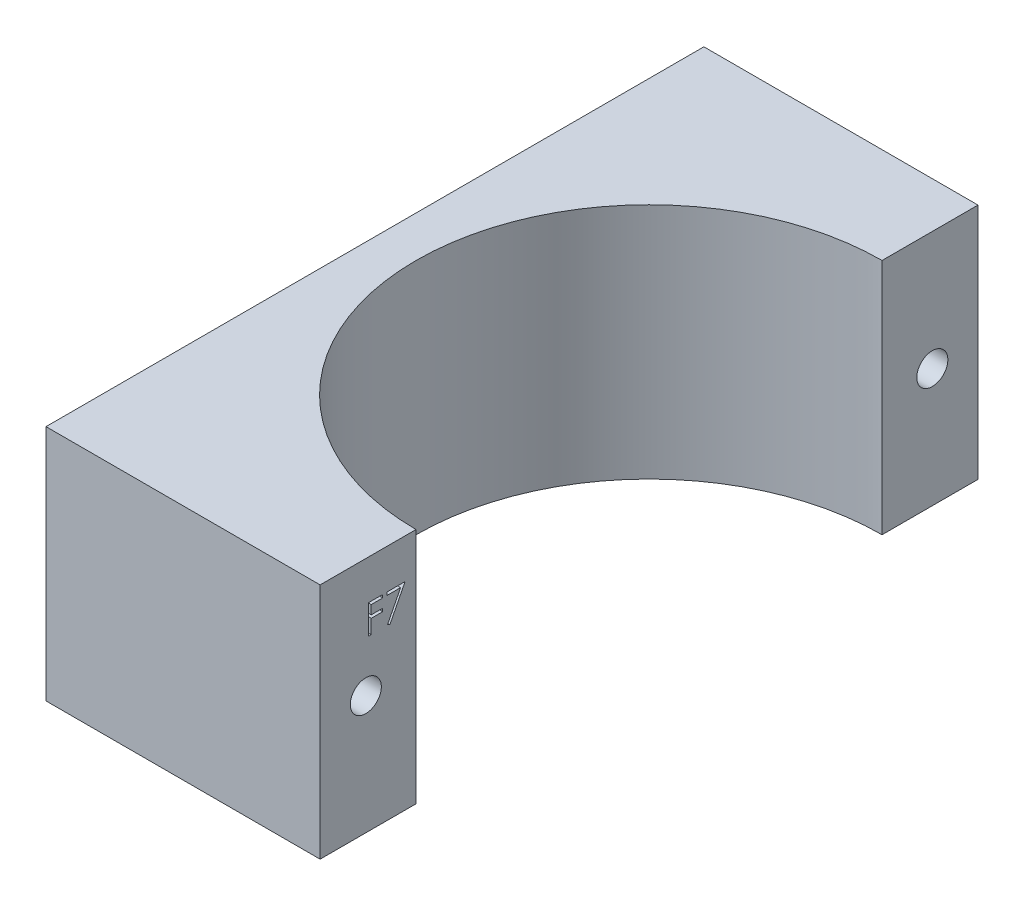
from build123d import *

# Parameters (mm, degrees)
BOSS_EXTRUDE1_DEPTH = 26
SKETCH2_R           = 1.7
CUT_EXTRUDE1_DEPTH  = 56.982083504
CUT_EXTRUDE2_DEPTH  = 1


with BuildPart() as part:
    # Sketch1 → Boss-Extrude1 (new body)
    with BuildSketch(Plane(origin=(0, 0, 0), x_dir=(1, 0, 0), z_dir=(0, 1, 0))):
        with BuildLine():
            Line((-46.998275301, 32.528571429), (-46.998275301, -39.471428571))
            Line((-46.998275301, -39.471428571), (-16.998275301, -39.471428571))
            Line((-16.998275301, -39.471428571), (-16.998275301, -28.971428571))
            ThreePointArc((-16.998275301, -28.971428571), (-42.498275301, -3.471428571), (-16.998275301, 22.028571429))
            Line((-16.998275301, 22.028571429), (-16.998275301, 32.528571429))
            Line((-16.998275301, 32.528571429), (-46.998275301, 32.528571429))
        make_face()
    extrude(amount=BOSS_EXTRUDE1_DEPTH)

    # Sketch2 → Cut-Extrude1 (cut, through all)
    with BuildSketch(Plane(origin=(-16.998275301, 0, 0), x_dir=(0, 0, -1), z_dir=(1, 0, 0))):
        with Locations((-34.471428571, 13)):
            Circle(SKETCH2_R)
        with Locations((27.528571429, 13)):
            Circle(SKETCH2_R)
    extrude(amount=-CUT_EXTRUDE1_DEPTH, mode=Mode.SUBTRACT)

    # Sketch3 → Cut-Extrude2 (cut)
    with BuildSketch(Plane(origin=(-16.998275301, 0, 0), x_dir=(0, 0, -1), z_dir=(1, 0, 0))):
        Polygon((-34.164231178, 21.664809495), (-32.617436306, 21.664809495), (-32.617436306, 21.33916847), (-33.87929528, 21.33916847), (-33.87929528, 20.362245393), (-32.617436306, 20.362245393), (-32.617436306, 20.036604367), (-33.87929528, 20.036604367), (-33.87929528, 18.489809495), (-34.164231178, 18.489809495), align=None)
        Polygon((-32.128974768, 21.664809495), (-30.175128614, 21.664809495), (-31.84403887, 18.408399239), (-32.090177692, 18.543870994), (-30.657865994, 21.33916847), (-32.128974768, 21.33916847), align=None)
    extrude(amount=-CUT_EXTRUDE2_DEPTH, mode=Mode.SUBTRACT)


solid = part.part
